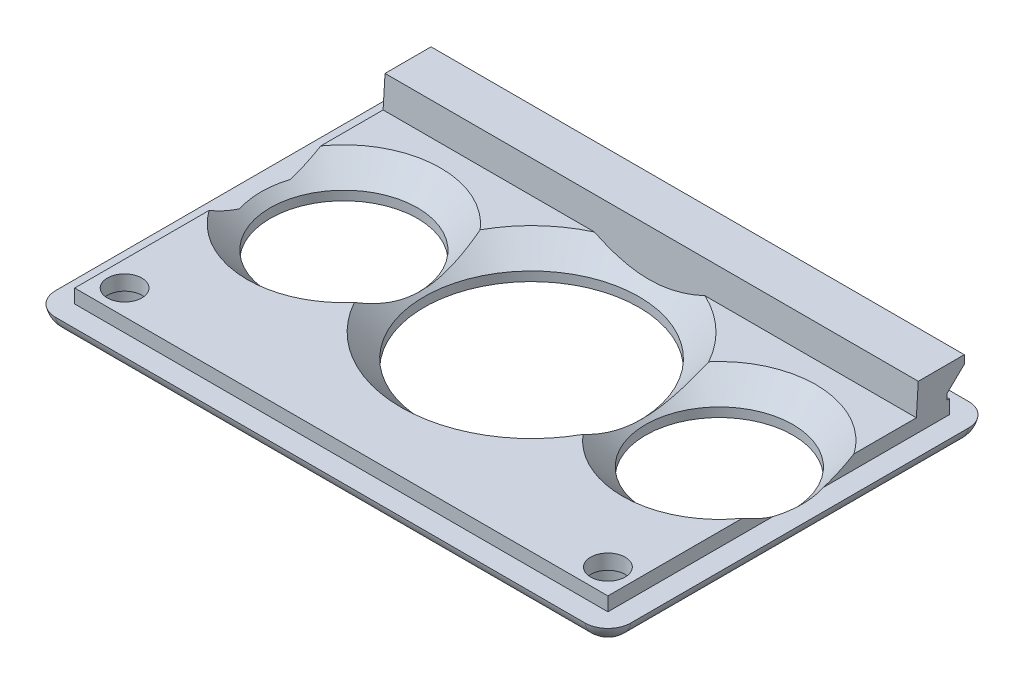
from build123d import *

# Parameters (mm, degrees)
SKETCH1_W           = 75
SKETCH1_H           = 50
BOSS_EXTRUDE1_DEPTH = 2.4
SKETCH2_W           = 69.5
SKETCH2_H           = 44.5
BOSS_EXTRUDE2_DEPTH = 1.8
SKETCH4_R           = 9.6
SKETCH4_R_2         = 14
SKETCH4_R_3         = 2.25
CUT_EXTRUDE1_DEPTH  = 90.866129507
BOSS_EXTRUDE3_DEPTH = 69.5
FILLET1_R           = 3
FILLET2_R           = 3
SKETCH7_R           = 3
CUT_EXTRUDE3_DEPTH  = 2.25
CHAMFER1_SIZE       = 3


with BuildPart() as part:
    # Sketch1 → Boss-Extrude1 (new body)
    with BuildSketch(Plane(origin=(0, 0, 0), x_dir=(1, 0, 0), z_dir=(0, 1, 0))):
        with Locations((36.253665689, 26.173020528)):
            Rectangle(SKETCH1_W, SKETCH1_H)
    extrude(amount=BOSS_EXTRUDE1_DEPTH)

    # Sketch2 → Boss-Extrude2 (add)
    with BuildSketch(Plane(origin=(0, 2.4, 0), x_dir=(1, 0, 0), z_dir=(0, 1, 0))):
        with Locations((36.253665689, 26.173020528)):
            Rectangle(SKETCH2_W, SKETCH2_H)
    extrude(amount=BOSS_EXTRUDE2_DEPTH)

    # Sketch4 → Cut-Extrude1 (cut, through all)
    with BuildSketch(Plane(origin=(0, 0, 0), x_dir=(-1, 0, 0), z_dir=(0, -1, 0))):
        with Locations(Location((-60.718665689, 28.723020528, 0), (0, 0, 90))):
            Circle(SKETCH4_R)
        with Locations(Location((-36.253665689, 28.723020528, 0), (0, 0, 90))):
            Circle(SKETCH4_R_2)
        with Locations(Location((-11.788665689, 28.723020528, 0), (0, 0, 90))):
            Circle(SKETCH4_R)
        with Locations(Location((-67.753665689, 7.173020528, 0), (0, 0, 90))):
            Circle(SKETCH4_R_3)
        with Locations(Location((-4.753665689, 7.180899965, 0), (0, 0, 90))):
            Circle(SKETCH4_R_3)
    extrude(amount=-CUT_EXTRUDE1_DEPTH, mode=Mode.SUBTRACT)

    # Sketch5 → Boss-Extrude3 (add)
    with BuildSketch(Plane(origin=(71.003665689, 0, 0), x_dir=(0, 0, -1), z_dir=(1, 0, 0))):
        Polygon((48.123020528, 4.2), (44.123020528, 4.2), (44.373020528, 8.2), (50.373020528, 8.2), (50.373020528, 7.1), (48.142477117, 4.978263585), align=None)
    extrude(amount=-BOSS_EXTRUDE3_DEPTH)

    # Fillet1
    fillet1_edges = [part.edges().sort_by_distance(p)[0] for p in [
        (-1.246334311, 1.2, -51.173020528),
        (73.753665689, 1.2, -51.173020528),
        (73.753665689, 1.2, -1.173020528),
        (-1.246334311, 1.2, -1.173020528),
    ]]
    fillet(fillet1_edges, radius=FILLET1_R)

    # Fillet2
    # the kernel refuses this fillet: 3 mm, written as the material it takes off along each edge
    with BuildSketch(Plane(origin=(1.753665689, 0, -48.173020528), x_dir=(-1, 0, 0), z_dir=(0, 0, 1))) as fillet2_piece_1:
        with BuildLine():
            CenterArc((0.060612309, -3), FILLET2_R, 11.536959033, 78.463040967)
            Line((3, -2.4), (3.058787754, -2.388))
            ThreePointArc((3.058787754, -2.388), (3.06, -1.2), (3.06, 0))
            Line((3.06, 0), (3, 0.06))
            Line((3, 0.06), (0.060612309, 0.06))
            Line((0.060612309, 0.06), (0.060612309, 0))
        make_face()
    revolve(axis=Axis((1.753665689, 0, -48.173020528), (0, -1, 0)), revolution_arc=90, mode=Mode.SUBTRACT)
    with BuildSketch(Plane(origin=(70.753665689, 0, -51.173020528), x_dir=(0, 0, 1), z_dir=(-1, 0, 0))) as fillet2_piece_2:
        with BuildLine():
            CenterArc((2.939387691, 3), FILLET2_R, 191.536959033, 78.463040967)
            Line((0, 2.4), (-0.058787754, 2.388))
            ThreePointArc((-0.058787754, 2.388), (-0.06, 1.2), (-0.06, 0))
            Line((-0.06, 0), (0, -0.06))
            Line((0, -0.06), (2.939387691, -0.06))
            Line((2.939387691, -0.06), (2.939387691, 0))
        make_face()
    extrude(amount=69, mode=Mode.SUBTRACT)
    with BuildSketch(Plane(origin=(70.753665689, 0, -48.173020528), x_dir=(1, 0, 0), z_dir=(0, 0, 1))) as fillet2_piece_3:
        with BuildLine():
            CenterArc((0.060612309, 3), FILLET2_R, 270, 78.463040967)
            Line((3, 2.4), (3.058787754, 2.388))
            ThreePointArc((3.058787754, 2.388), (3.06, 1.2), (3.06, 0))
            Line((3.06, 0), (3, -0.06))
            Line((3, -0.06), (0.060612309, -0.06))
            Line((0.060612309, -0.06), (0.060612309, 0))
        make_face()
    revolve(axis=Axis((70.753665689, 0, -48.173020528), (0, 1, 0)), revolution_arc=90, mode=Mode.SUBTRACT)
    with BuildSketch(Plane(origin=(73.753665689, 0, -4.173020528), x_dir=(-1, 0, 0), z_dir=(0, 0, -1)), Plane(origin=(-1.246334311, 0, -48.173020528), x_dir=(1, 0, 0), z_dir=(0, 0, 1))) as fillet2_piece_4:
        with BuildLine():
            CenterArc((2.939387691, 3), FILLET2_R, 191.536959033, 78.463040967)
            Line((0, 2.4), (-0.058787754, 2.388))
            ThreePointArc((-0.058787754, 2.388), (-0.06, 1.2), (-0.06, 0))
            Line((-0.06, 0), (0, -0.06))
            Line((0, -0.06), (2.939387691, -0.06))
            Line((2.939387691, -0.06), (2.939387691, 0))
        make_face()
    extrude(amount=44, mode=Mode.SUBTRACT)
    with BuildSketch(Plane(origin=(70.753665689, 0, -4.173020528), x_dir=(0, 0, 1), z_dir=(-1, 0, 0))) as fillet2_piece_5:
        with BuildLine():
            CenterArc((0.060612309, 3), FILLET2_R, 270, 78.463040967)
            Line((3, 2.4), (3.058787754, 2.388))
            ThreePointArc((3.058787754, 2.388), (3.06, 1.2), (3.06, 0))
            Line((3.06, 0), (3, -0.06))
            Line((3, -0.06), (0.060612309, -0.06))
            Line((0.060612309, -0.06), (0.060612309, 0))
        make_face()
    revolve(axis=Axis((70.753665689, 0, -4.173020528), (0, 1, 0)), revolution_arc=90, mode=Mode.SUBTRACT)
    with BuildSketch(Plane(origin=(1.753665689, 0, -1.173020528), x_dir=(0, 1.0, -1.5658770576478976e-12), z_dir=(1, 0, 0))) as fillet2_piece_6:
        with BuildLine():
            CenterArc((3, -2.939387691), FILLET2_R, 101.536959033, 78.463040967)
            Line((0, -2.939387691), (-0.06, -2.939387691))
            Line((-0.06, -2.939387691), (-0.06, 0))
            Line((-0.06, 0), (0, 0.06))
            ThreePointArc((0, 0.06), (1.2, 0.06), (2.388, 0.058787754))
            Line((2.388, 0.058787754), (2.4, 0))
        make_face()
    extrude(amount=69, mode=Mode.SUBTRACT)
    with BuildSketch(Plane(origin=(1.753665689, 0, -4.173020528), x_dir=(0, 0, 1), z_dir=(1, 0, 0))) as fillet2_piece_7:
        with BuildLine():
            CenterArc((0.060612309, -3), FILLET2_R, 11.536959033, 78.463040967)
            Line((3, -2.4), (3.058787754, -2.388))
            ThreePointArc((3.058787754, -2.388), (3.06, -1.2), (3.06, 0))
            Line((3.06, 0), (3, 0.06))
            Line((3, 0.06), (0.060612309, 0.06))
            Line((0.060612309, 0.06), (0.060612309, 0))
        make_face()
    revolve(axis=Axis((1.753665689, 0, -4.173020528), (0, -1, 0)), revolution_arc=90, mode=Mode.SUBTRACT)

    # Sketch7 → Cut-Extrude3 (cut)
    with BuildSketch(Plane.XZ):
        with Locations(Location((4.753665689, -7.180899965, 0), (0, 0, 270))):
            Circle(SKETCH7_R)
        with Locations(Location((67.753665689, -7.173020528, 0), (0, 0, 270))):
            Circle(SKETCH7_R)
    extrude(amount=-CUT_EXTRUDE3_DEPTH, mode=Mode.SUBTRACT)

    # Chamfer1
    # the kernel refuses this chamfer: 3 mm, written as the material it takes off along each edge
    with BuildSketch(Plane(origin=(11.788665689, 4.2, -28.723020528), x_dir=(0, 0, -1), z_dir=(-1, 0, 0))) as chamfer1_piece_1:
        Polygon((9.6 + CHAMFER1_SIZE, 0), (9.6, CHAMFER1_SIZE), (9.6, 0), align=None)
    revolve(axis=Axis((11.788665689, 4.2, -28.723020528), (0, -1, 0)), mode=Mode.SUBTRACT)
    with BuildSketch(Plane(origin=(36.253665689, 4.2, -28.723020528), x_dir=(0, 0, -1), z_dir=(-1, 0, 0))) as chamfer1_piece_2_section:
        Polygon((14 + CHAMFER1_SIZE, 0), (14, CHAMFER1_SIZE), (14, 0), align=None)
    chamfer1_piece_2 = revolve(axis=Axis((36.253665689, 4.2, -28.723020528), (0, -1, 0)), mode=Mode.PRIVATE)
    chamfer1_piece_2 = split(chamfer1_piece_2, bisect_by=Plane(origin=(36.253665689, 0.839630842, -43.912997455), z_dir=(0, 0.06237828615517877, 0.9980525784828888)), keep=Keep.TOP, mode=Mode.PRIVATE)
    add(chamfer1_piece_2, mode=Mode.SUBTRACT)
    with BuildSketch(Plane(origin=(60.718665689, 4.2, -28.723020528), x_dir=(0, 0, -1), z_dir=(-1, 0, 0))) as chamfer1_piece_3:
        Polygon((9.6 + CHAMFER1_SIZE, 0), (9.6, CHAMFER1_SIZE), (9.6, 0), align=None)
    revolve(axis=Axis((60.718665689, 4.2, -28.723020528), (0, -1, 0)), mode=Mode.SUBTRACT)


solid = part.part
